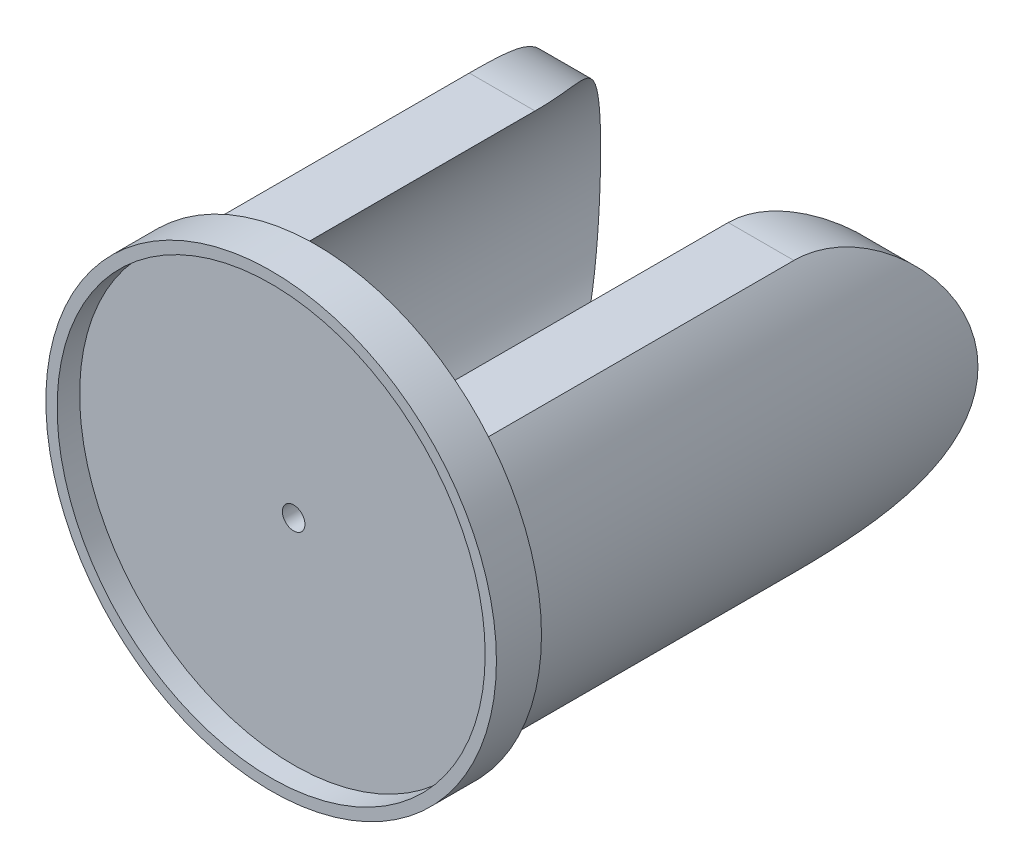
from build123d import *

# Parameters (mm, degrees)
ESQUISSE1_R             = 50
BOSS_EXTRU_1_DEPTH      = 10
ESQUISSE2_R             = 47.5
ENL_V_MAT_EXTRU_1_DEPTH = 5
ESQUISSE3_R             = 2.5
ENL_V_MAT_EXTRU_2_DEPTH = 16
ESQUISSE4_R             = 35
BOSS_EXTRU_2_DEPTH      = 7
BOSS_EXTRU_3_DEPTH      = 100
CONG_1_R                = 30


with BuildPart() as part:
    # Esquisse1 → Boss.-Extru.1 (new body)
    with BuildSketch(Plane.XY):
        Circle(ESQUISSE1_R)
    extrude(amount=BOSS_EXTRU_1_DEPTH)

    # Esquisse2 → Enlèv. mat.-Extru.1 (cut)
    with BuildSketch(Plane.XY.offset(10)):
        Circle(ESQUISSE2_R)
    extrude(amount=-ENL_V_MAT_EXTRU_1_DEPTH, mode=Mode.SUBTRACT)

    # Esquisse3 → Enlèv. mat.-Extru.2 (cut)
    with BuildSketch(Plane(origin=(0, 0, 0), x_dir=(-1, 0, 0), z_dir=(0, 0, -1))):
        Circle(ESQUISSE3_R)
    extrude(amount=-ENL_V_MAT_EXTRU_2_DEPTH, mode=Mode.SUBTRACT)

    # Esquisse4 → Boss.-Extru.2 (add)
    with BuildSketch(Plane(origin=(0, 0, 0), x_dir=(-1, 0, 0), z_dir=(0, 0, -1))):
        Circle(ESQUISSE4_R)
    extrude(amount=BOSS_EXTRU_2_DEPTH)

    # Esquisse5 → Boss.-Extru.3 (add)
    with BuildSketch(Plane(origin=(0, 0, 0), x_dir=(-1, 0, 0), z_dir=(0, 0, -1))):
        with BuildLine():
            Line((-46.875, 0), (-36.875, 0))
            ThreePointArc((-36.875, 0), (-32.790583699, 16.868409696), (-21.442145998, 30))
            Line((-21.442145998, 30), (-36.017573836, 30))
            ThreePointArc((-36.017573836, 30), (-44.077144863, 15.952144863), (-46.875, 0))
        make_face()
        with BuildLine():
            ThreePointArc((-21.442145998, -30), (-32.790583699, -16.868409696), (-36.875, 0))
            Line((-36.875, 0), (-46.875, 0))
            ThreePointArc((-46.875, 0), (-44.077144863, -15.952144863), (-36.017573836, -30))
            Line((-36.017573836, -30), (-21.442145998, -30))
        make_face()
        with BuildLine():
            ThreePointArc((21.442145998, 30), (32.790583699, 16.868409696), (36.875, 0))
            Line((36.875, 0), (46.875, 0))
            ThreePointArc((46.875, 0), (44.077144863, 15.952144863), (36.017573836, 30))
            Line((36.017573836, 30), (21.442145998, 30))
        make_face()
        with BuildLine():
            Line((46.875, 0), (36.875, 0))
            ThreePointArc((36.875, 0), (32.790583699, -16.868409696), (21.442145998, -30))
            Line((21.442145998, -30), (36.017573836, -30))
            ThreePointArc((36.017573836, -30), (44.077144863, -15.952144863), (46.875, 0))
        make_face()
    extrude(amount=BOSS_EXTRU_3_DEPTH)

    # Congé1
    # the kernel refuses this fillet: 30 mm, written as the material it takes off along each edge
    with BuildSketch(Plane(origin=(-53.557854002, 30, -100), x_dir=(0, 0, 1), z_dir=(1, 0, 0)), Plane(origin=(-111.017573836, 30, -100), x_dir=(0, 0, 1), z_dir=(1, 0, 0)), Plane(origin=(111.017573836, -30, -100), x_dir=(0, 0, 1), z_dir=(-1, 0, 0)), Plane(origin=(53.557854002, -30, -100), x_dir=(0, 0, 1), z_dir=(-1, 0, 0))) as cong_1_piece_1:
        with BuildLine():
            CenterArc((CONG_1_R, CONG_1_R), CONG_1_R, 180, 90)
            Line((0, CONG_1_R), (0, 0))
            Line((0, 0), (CONG_1_R, 0))
        make_face()
    extrude(amount=164.575427838, mode=Mode.SUBTRACT)


solid = part.part
